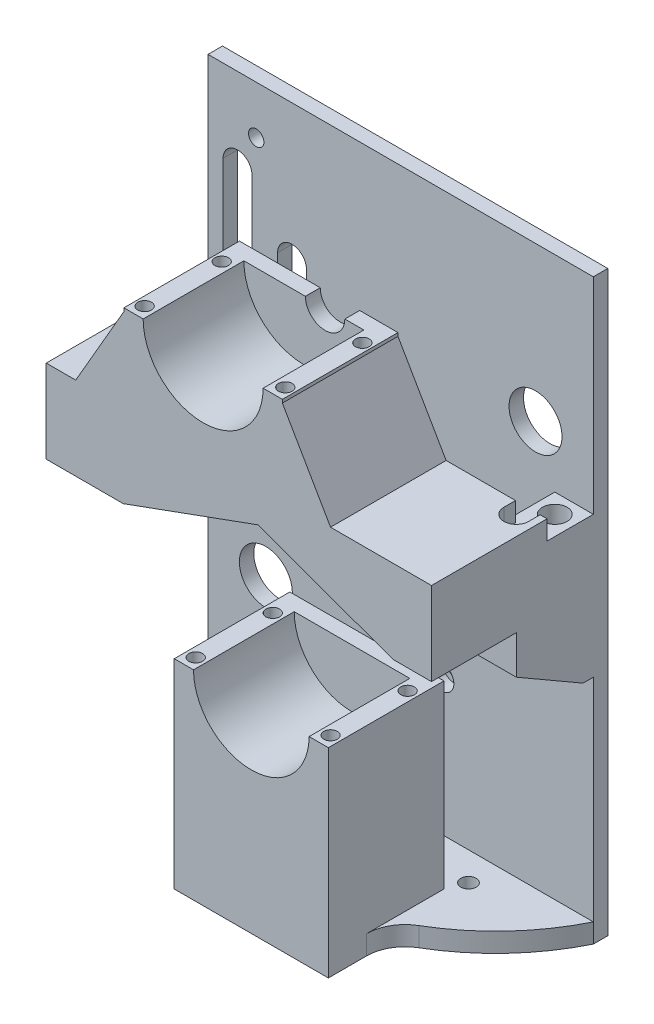
from build123d import *
from OCP.BRepFilletAPI import BRepFilletAPI_MakeChamfer

# Parameters (mm, degrees)
SKETCH1_W                      = 127
SKETCH1_H                      = 101.6
BOSS_EXTRUDE1_DEPTH            = 4.7625
SKETCH2_W                      = 127
SKETCH2_H                      = 6.35
BOSS_EXTRUDE2_DEPTH            = 50.8
CUT_EXTRUDE1_DEPTH             = 96.882897328
CUT_EXTRUDE1_DEPTH_BACK        = 96.882897328
SKETCH3_R                      = 8.73125
CUT_EXTRUDE2_DEPTH             = 96.882897328
CUT_EXTRUDE2_DEPTH_BACK        = 96.882897328
SKETCH4_R                      = 2.286
CUT_EXTRUDE3_DEPTH             = 128.247805114
CUT_EXTRUDE3_DEPTH_BACK        = 128.247805114
SKETCH5_R                      = 2.54
CUT_EXTRUDE4_START             = -6.35
CUT_EXTRUDE4_DEPTH             = 6.35
SKETCH7_R                      = 4.064
CUT_EXTRUDE5_DEPTH             = 4.318
BOSS_EXTRUDE3_DEPTH            = 38.1
BOSS_EXTRUDE4_DEPTH            = 4.9
SKETCH15_W                     = 25.4
SKETCH15_H                     = 25.4
SKETCH15_W_2                   = 12.7
BOSS_EXTRUDE5_DEPTH            = 25.4
CHAMFER1_SIZE                  = 12.7
CHAMFER1_SIZE2                 = 21.997045256
SKETCH17_W                     = 127
SKETCH17_H                     = 4.7625
BOSS_EXTRUDE6_DEPTH            = 88.9
CUT_EXTRUDE7_DEPTH             = 163.460750952
CUT_EXTRUDE7_DEPTH_BACK        = 163.460750952
SKETCH18_R                     = 8.73125
SKETCH31_R                     = 2.249999945
CUT_EXTRUDE16_DEPTH            = 7
BOSS_EXTRUDE7_DEPTH            = 53.34
SKETCH20_W                     = 127
SKETCH20_H                     = 27.442580258
BOSS_EXTRUDE8_DEPTH            = 53.34
CUT_EXTRUDE8_REACH             = 166.086
CUT_EXTRUDE8_DIRECTION_2_DEPTH = 165.086076515
CHAMFER2_SIZE                  = 15.875
CHAMFER2_SIZE2                 = 27.49630657
CUT_EXTRUDE9_DEPTH             = 198.537314212
CUT_EXTRUDE9_DEPTH_BACK        = 198.537314212
SKETCH22_W                     = 15.24
SKETCH22_H                     = 47.382896715
SKETCH23_W                     = 88.9
SKETCH23_H                     = 15.24
CUT_EXTRUDE10_DEPTH            = 134.156714086
BOSS_EXTRUDE9_DEPTH            = 4.9
SKETCH16_R                     = 2.25
CUT_EXTRUDE6_DEPTH             = 134.156714086
SKETCH26_R                     = 4.064
CUT_EXTRUDE11_DEPTH            = 21.092580258
SKETCH27_W                     = 7.440852829
SKETCH27_H                     = 3.81
SKETCH27_W_2                   = 8.128
CUT_EXTRUDE12_DEPTH            = 6.35
CUT_EXTRUDE13_DEPTH            = 163.460750952
CUT_EXTRUDE13_DEPTH_BACK       = 163.460750952
SKETCH28_R                     = 2.54
CUT_EXTRUDE14_DEPTH            = 165.086076515
CUT_EXTRUDE14_DEPTH_BACK       = 4.7625
SKETCH29_W                     = 9.525
SKETCH29_H                     = 38.1
FILLET1_R                      = 4.7625
SKETCH30_R                     = 2.25
CUT_EXTRUDE15_DEPTH            = 7
BOSS_EXTRUDE10_START           = 6.35
BOSS_EXTRUDE10_DEPTH           = 6.35
FILLET2_R                      = 12.7


# Read off the part's stored shape, not the designer's step: Cut-Extrude4
with BuildPart() as part:
    # Sketch1 → Boss-Extrude1 (new body)
    with BuildSketch(Plane.XY):
        Rectangle(SKETCH1_W, SKETCH1_H)
    extrude(amount=BOSS_EXTRUDE1_DEPTH)

    # Sketch2 → Boss-Extrude2 (add)
    with BuildSketch(Plane.XY.offset(4.7625)):
        with Locations((0, -47.625)):
            Rectangle(SKETCH2_W, SKETCH2_H)
    extrude(amount=BOSS_EXTRUDE2_DEPTH)

    # Sketch3 → Cut-Extrude1 (cut, two sides: drawn at the far end of the back side and taken through both)
    with BuildSketch(Plane.XY.offset(4.7625).offset(-CUT_EXTRUDE1_DEPTH_BACK)):
        with Locations((-44.45, 0)):
            Circle(SKETCH3_R)
    extrude(amount=CUT_EXTRUDE1_DEPTH + CUT_EXTRUDE1_DEPTH_BACK, mode=Mode.SUBTRACT)

    # Sketch4 → Cut-Extrude2 (cut, two sides: drawn at the far end of the back side and taken through both)
    with BuildSketch(Plane.XY.offset(4.7625).offset(-CUT_EXTRUDE2_DEPTH_BACK)):
        with Locations((13.462, 0.508)):
            Circle(SKETCH4_R)
    extrude(amount=CUT_EXTRUDE2_DEPTH + CUT_EXTRUDE2_DEPTH_BACK, mode=Mode.SUBTRACT)

    # Sketch5 → Cut-Extrude3 (cut, two sides: drawn at the far end of the back side and taken through both)
    with BuildSketch(Plane(origin=(0, -44.45, 0), x_dir=(1, 0, 0), z_dir=(0, 1, 0)).offset(-CUT_EXTRUDE3_DEPTH_BACK)):
        with Locations(Location((-31.75, -14.1605, 0), (0, 0, 270))):
            Circle(SKETCH5_R)
        with Locations(Location((0, -14.1605, 0), (0, 0, 270))):
            Circle(SKETCH5_R)
        with Locations(Location((31.75, -14.1605, 0), (0, 0, 270))):
            Circle(SKETCH5_R)
    extrude(amount=CUT_EXTRUDE3_DEPTH + CUT_EXTRUDE3_DEPTH_BACK, mode=Mode.SUBTRACT)

    # Cut-Extrude4 outline → Cut-Extrude4 (cut)
    with BuildSketch(Plane(origin=(0, -44.45, 0), x_dir=(1, 0, 0), z_dir=(0, 1, 0)).offset(CUT_EXTRUDE4_START)):
        with BuildLine():
            ThreePointArc((63.5, -4.7625), (0, -44.289932413), (-63.5, -4.7625))
            Line((-63.5, -4.7625), (-63.5, -55.5625))
            Line((-63.5, -55.5625), (63.5, -55.5625))
            Line((63.5, -55.5625), (63.5, -4.7625))
        make_face()
    extrude(amount=CUT_EXTRUDE4_DEPTH, mode=Mode.SUBTRACT)

    # Sketch7 → Cut-Extrude5 (cut)
    with BuildSketch(Plane.XY.offset(4.7625)):
        with Locations((13.462, 0.508)):
            Circle(SKETCH7_R)
    extrude(amount=-CUT_EXTRUDE5_DEPTH, mode=Mode.SUBTRACT)

    # Sketch11 → Boss-Extrude3 (add)
    with BuildSketch(Plane.XY.offset(20.0025)):
        with BuildLine():
            Line((-14.949479175, 14.949479175), (-21.299479175, 14.949479175))
            Line((-21.299479175, 14.949479175), (-21.299479175, -44.45))
            Line((-21.299479175, -44.45), (29.500520825, -44.45))
            Line((29.500520825, -44.45), (29.500520825, 14.949479175))
            Line((29.500520825, 14.949479175), (23.150520825, 14.949479175))
            ThreePointArc((23.150520825, 14.949479175), (4.100520825, -4.100520825), (-14.949479175, 14.949479175))
        make_face()
    extrude(amount=BOSS_EXTRUDE3_DEPTH)

    # Sketch14 → Boss-Extrude4 (add)
    with BuildSketch(Plane.XY.offset(20.0025)):
        with BuildLine():
            Line((-14.949479175, 14.949479175), (23.150520825, 14.949479175))
            ThreePointArc((23.150520825, 14.949479175), (4.100520825, -4.100520825), (-14.949479175, 14.949479175))
        make_face()
    extrude(amount=BOSS_EXTRUDE4_DEPTH)

    # Sketch15 → Boss-Extrude5 (add)
    with BuildSketch(Plane.XY.offset(4.7625)):
        with Locations((-50.8, 38.1)):
            Rectangle(SKETCH15_W, SKETCH15_H)
        with Locations((57.15, 38.1)):
            Rectangle(SKETCH15_W_2, SKETCH15_H)
    extrude(amount=BOSS_EXTRUDE5_DEPTH)

    # Chamfer1: one chamfer whose edges measure the first distance from different faces: ONE call of the kernel's chamfer builder (chamfer() names one face for all edges)
    chamfer1_edges_1 = [part.edges().sort_by_distance(p)[0] for p in [
        (-50.8, 25.4, 30.1625),
    ]]
    chamfer1_side_1 = [part.faces().sort_by_distance(p)[0] for p in [
        (-50.8, 38.1, 30.1625),
    ]]
    chamfer1_edges_2 = [part.edges().sort_by_distance(p)[0] for p in [
        (57.15, 25.4, 30.1625),
    ]]
    chamfer1_side_2 = [part.faces().sort_by_distance(p)[0] for p in [
        (57.15, 38.1, 30.1625),
    ]]
    chamfer1 = BRepFilletAPI_MakeChamfer(part.part.solid().wrapped)
    for e in chamfer1_edges_1:
        chamfer1.Add(CHAMFER1_SIZE, CHAMFER1_SIZE2, e.wrapped, chamfer1_side_1[0].wrapped)  # the first distance lies on this face
    for e in chamfer1_edges_2:
        chamfer1.Add(CHAMFER1_SIZE, CHAMFER1_SIZE2, e.wrapped, chamfer1_side_2[0].wrapped)  # the first distance lies on this face
    add(Compound.cast(chamfer1.Shape()), mode=Mode.REPLACE)

    # Sketch17 → Boss-Extrude6 (add)
    with BuildSketch(Plane(origin=(0, 50.8, 0), x_dir=(1, 0, 0), z_dir=(0, 1, 0))):
        with Locations((0, -2.38125)):
            Rectangle(SKETCH17_W, SKETCH17_H)
    extrude(amount=BOSS_EXTRUDE6_DEPTH)

    # Sketch18 → Cut-Extrude7 (cut, two sides: drawn at the far end of the back side and taken through both)
    with BuildSketch(Plane.XY.offset(4.7625).offset(-CUT_EXTRUDE7_DEPTH_BACK)):
        with Locations((44.45, 88.9)):
            Circle(SKETCH18_R)
    extrude(amount=CUT_EXTRUDE7_DEPTH + CUT_EXTRUDE7_DEPTH_BACK, mode=Mode.SUBTRACT)

    # Sketch31 → Cut-Extrude16 (cut)
    with BuildSketch(Plane(origin=(0, 14.949479175, 0), x_dir=(1, 0, 0), z_dir=(0, 1, 0))):
        with Locations(Location((-18.124479175, -28.8025, 0), (0, 0, 270))):
            Circle(SKETCH31_R)
        with Locations(Location((26.325520825, -28.8025, 0), (0, 0, 270))):
            Circle(SKETCH31_R)
        with Locations(Location((26.325520825, -54.2025, 0), (0, 0, 270))):
            Circle(SKETCH31_R)
        with Locations(Location((-18.124479175, -54.2025, 0), (0, 0, 270))):
            Circle(SKETCH31_R)
    extrude(amount=-CUT_EXTRUDE16_DEPTH, mode=Mode.SUBTRACT)

    # Sketch19 → Boss-Extrude7 (add)
    with BuildSketch(Plane.XY.offset(4.7625)):
        with BuildLine():
            Line((-31.548147171, 106.817580258), (-37.898147171, 106.817580258))
            Line((-37.898147171, 106.817580258), (-37.898147171, 78.242580258))
            Line((-37.898147171, 78.242580258), (14.341852829, 78.242580258))
            Line((14.341852829, 78.242580258), (14.341852829, 106.817580258))
            Line((14.341852829, 106.817580258), (7.991852829, 106.817580258))
            ThreePointArc((7.991852829, 106.817580258), (-11.778147171, 87.047580258), (-31.548147171, 106.817580258))
        make_face()
    extrude(amount=BOSS_EXTRUDE7_DEPTH)

    # Sketch20 → Boss-Extrude8 (add)
    with BuildSketch(Plane.XY.offset(4.7625)):
        with Locations((0, 64.521290129)):
            Rectangle(SKETCH20_W, SKETCH20_H)
    extrude(amount=BOSS_EXTRUDE8_DEPTH)

    # Cut-Extrude8: up to this face of the body (flat: up to its plane)
    cut_extrude8_end = Plane(part.part.faces().sort_by_distance((2.240886483, 0.139322847, 4.7625))[0])
    # Sketch21 → Cut-Extrude8 (cut, up to the picked face)
    with BuildSketch(Plane.XY.offset(58.1025), mode=Mode.PRIVATE) as cut_extrude8_sk1:
        Polygon((-38.1, 50.8), (6.35, 66.978476913), (50.8, 50.8), align=None)
    cut_extrude8_tool1 = split(extrude(cut_extrude8_sk1.sketch, amount=-CUT_EXTRUDE8_REACH, mode=Mode.PRIVATE), bisect_by=cut_extrude8_end, keep=Keep.BOTH, mode=Mode.PRIVATE)
    add(cut_extrude8_tool1.solids().sort_by(Axis((6.35, 56.192826, 58.1025), (0, 0, -1)))[0], mode=Mode.SUBTRACT)

    # Sketch21 → Cut-Extrude8 direction 2 (cut)
    with BuildSketch(Plane.XY.offset(58.1025)):
        Polygon((-38.1, 50.8), (6.35, 66.978476913), (50.8, 50.8), align=None)
    extrude(amount=CUT_EXTRUDE8_DIRECTION_2_DEPTH, mode=Mode.SUBTRACT)

    # Chamfer2: one chamfer whose edges measure the first distance from different faces: ONE call of the kernel's chamfer builder (chamfer() names one face for all edges)
    chamfer2_edges_1 = [part.edges().sort_by_distance(p)[0] for p in [
        (-37.898147171, 78.242580258, 31.4325),
    ]]
    chamfer2_side_1 = [part.faces().sort_by_distance(p)[0] for p in [
        (-50.699073586, 78.242580258, 31.4325),
    ]]
    chamfer2_edges_2 = [part.edges().sort_by_distance(p)[0] for p in [
        (14.341852829, 78.242580258, 31.4325),
    ]]
    chamfer2_side_2 = [part.faces().sort_by_distance(p)[0] for p in [
        (38.920926414, 78.242580258, 31.4325),
    ]]
    chamfer2 = BRepFilletAPI_MakeChamfer(part.part.solid().wrapped)
    for e in chamfer2_edges_1:
        chamfer2.Add(CHAMFER2_SIZE, CHAMFER2_SIZE2, e.wrapped, chamfer2_side_1[0].wrapped)  # the first distance lies on this face
    for e in chamfer2_edges_2:
        chamfer2.Add(CHAMFER2_SIZE, CHAMFER2_SIZE2, e.wrapped, chamfer2_side_2[0].wrapped)  # the first distance lies on this face
    add(Compound.cast(chamfer2.Shape()), mode=Mode.REPLACE)

    # Sketch22 → Cut-Extrude9 (cut, two sides: drawn at the far end of the back side and taken through both)
    with BuildSketch(Plane(origin=(63.5, 0, 0), x_dir=(0, 0, -1), z_dir=(1, 0, 0)).offset(-CUT_EXTRUDE9_DEPTH_BACK)):
        with Locations((-12.3825, 95.584028616)):
            Rectangle(SKETCH22_W, SKETCH22_H)
    extrude(amount=CUT_EXTRUDE9_DEPTH + CUT_EXTRUDE9_DEPTH_BACK, mode=Mode.SUBTRACT)

    # Sketch23 → Cut-Extrude10 (cut, through all)
    with BuildSketch(Plane.XZ.offset(-50.8)):
        with Locations((6.35, 12.3825)):
            Rectangle(SKETCH23_W, SKETCH23_H)
    extrude(amount=-CUT_EXTRUDE10_DEPTH, mode=Mode.SUBTRACT)

    # Sketch24 → Boss-Extrude9 (add)
    with BuildSketch(Plane.XY.offset(20.0025)):
        with BuildLine():
            Line((-11.278147171, 106.817580258), (-31.548147171, 106.817580258))
            ThreePointArc((-31.548147171, 106.817580258), (-11.778147171, 87.047580258), (7.991852829, 106.817580258))
            Line((7.991852829, 106.817580258), (1.721852829, 106.817580258))
            ThreePointArc((1.721852829, 106.817580258), (-4.778147171, 100.317580258), (-11.278147171, 106.817580258))
        make_face()
    extrude(amount=BOSS_EXTRUDE9_DEPTH)

    # Sketch16 → Cut-Extrude6 (cut, through all)
    with BuildSketch(Plane(origin=(0, 50.8, 0), x_dir=(1, 0, 0), z_dir=(0, 1, 0))):
        with Locations((57.15, -11.1125)):
            Circle(SKETCH16_R)
        with Locations((57.15, -23.8125)):
            Circle(SKETCH16_R)
        with Locations((-57.15, -11.1125)):
            Circle(SKETCH16_R)
        with Locations((-57.15, -23.8125)):
            Circle(SKETCH16_R)
    extrude(amount=CUT_EXTRUDE6_DEPTH, mode=Mode.SUBTRACT)

    # Sketch26 → Cut-Extrude11 (cut)
    with BuildSketch(Plane(origin=(0, 78.242580258, 0), x_dir=(1, 0, 0), z_dir=(0, 1, 0))):
        with Locations(Location((-57.15, -11.1125, 0), (0, 0, 270))):
            Circle(SKETCH26_R)
        with Locations(Location((-57.15, -23.8125, 0), (0, 0, 110.364134806))):
            Circle(SKETCH26_R)
        with Locations(Location((57.15, -11.1125, 0), (0, 0, 270))):
            Circle(SKETCH26_R)
        with Locations(Location((57.15, -23.8125, 0), (0, 0, 110.364134806))):
            Circle(SKETCH26_R)
    extrude(amount=-CUT_EXTRUDE11_DEPTH, mode=Mode.SUBTRACT)

    # Sketch27 → Cut-Extrude12 (cut)
    with BuildSketch(Plane(origin=(0, 78.242580258, 0), x_dir=(1, 0, 0), z_dir=(0, 1, 0))):
        with Locations((-57.493573586, -21.9075)):
            Rectangle(SKETCH27_W, SKETCH27_H)
        with Locations((57.15, -21.9075)):
            Rectangle(SKETCH27_W_2, SKETCH27_H)
    extrude(amount=-CUT_EXTRUDE12_DEPTH, mode=Mode.SUBTRACT)

    # Sketch28 → Cut-Extrude13 (cut, two sides: drawn at the far end of the back side and taken through both)
    with BuildSketch(Plane.XY.offset(4.7625).offset(-CUT_EXTRUDE13_DEPTH_BACK)):
        with Locations((-47.625, 123.825)):
            Circle(SKETCH28_R)
    extrude(amount=CUT_EXTRUDE13_DEPTH + CUT_EXTRUDE13_DEPTH_BACK, mode=Mode.SUBTRACT)

    # Sketch29 → Cut-Extrude14 (cut, two sides: drawn at the far end of the back side and taken through both)
    with BuildSketch(Plane(origin=(0, 0, 0), x_dir=(-1, 0, 0), z_dir=(0, 0, -1)).offset(-CUT_EXTRUDE14_DEPTH_BACK)):
        with Locations((35.814, 80.264)):
            Rectangle(SKETCH29_W, SKETCH29_H)
        with Locations((53.774512242, 98.224512242)):
            Rectangle(SKETCH29_W, SKETCH29_H)
    extrude(amount=CUT_EXTRUDE14_DEPTH + CUT_EXTRUDE14_DEPTH_BACK, mode=Mode.SUBTRACT)

    # Fillet1
    # the kernel refuses this fillet: 4.7625 mm, written as the material it adds along each edge
    with BuildSketch(Plane(origin=(-40.5765, 61.214, 0), x_dir=(0, 1, 0), z_dir=(0, 0, 1)), Plane(origin=(-31.0515, 99.314, 4.7625), x_dir=(-1, 0, 0), z_dir=(0, 0, -1)), Plane(origin=(-31.0515, 61.214, 4.7625), x_dir=(0, 1, 0), z_dir=(0, 0, -1)), Plane(origin=(-49.012012242, 79.174512242, 4.7625), x_dir=(0, 1, 0), z_dir=(0, 0, -1))) as fillet1_piece_1:
        with BuildLine():
            CenterArc((FILLET1_R, -FILLET1_R), FILLET1_R, 90, 90)
            Line((0, -FILLET1_R), (0, 0))
            Line((0, 0), (FILLET1_R, 0))
        make_face()
    extrude(amount=4.7625)
    with BuildSketch(Plane(origin=(-40.5765, 99.314, 0), x_dir=(0, -1, 0), z_dir=(0, 0, 1)), Plane(origin=(-58.537012242, 79.174512242, 0), x_dir=(1, 0, 0), z_dir=(0, 0, 1)), Plane(origin=(-58.537012242, 117.274512242, 0), x_dir=(0, -1, 0), z_dir=(0, 0, 1)), Plane(origin=(-49.012012242, 117.274512242, 4.7625), x_dir=(0, -1, 0), z_dir=(0, 0, -1))) as fillet1_piece_2:
        with BuildLine():
            CenterArc((FILLET1_R, FILLET1_R), FILLET1_R, 180, 90)
            Line((0, FILLET1_R), (0, 0))
            Line((0, 0), (FILLET1_R, 0))
        make_face()
    extrude(amount=4.7625)

    # Sketch30 → Cut-Extrude15 (cut)
    with BuildSketch(Plane(origin=(0, 106.817580258, 0), x_dir=(1, 0, 0), z_dir=(0, 1, 0))):
        with Locations(Location((-34.955647171, -28.8025, 0), (0, 0, 180))):
            Circle(SKETCH30_R)
        with Locations(Location((11.399352829, -28.8025, 0), (0, 0, 180))):
            Circle(SKETCH30_R)
        with Locations(Location((11.399352829, -54.2025, 0), (0, 0, 180))):
            Circle(SKETCH30_R)
        with Locations(Location((-34.955647171, -54.2025, 0), (0, 0, 180))):
            Circle(SKETCH30_R)
    extrude(amount=-CUT_EXTRUDE15_DEPTH, mode=Mode.SUBTRACT)

    # Sketch32 → Boss-Extrude10 (add)
    with BuildSketch(Plane.XZ.offset(44.45).offset(BOSS_EXTRUDE10_START)):
        with BuildLine():
            Line((29.500520825, 37.84803559), (29.500520825, 58.1025))
            Line((29.500520825, 58.1025), (-21.299479175, 58.1025))
            Line((-21.299479175, 58.1025), (-21.299479175, 41.008608218))
            ThreePointArc((-21.299479175, 41.008608218), (4.394493813, 44.15336054), (29.500520825, 37.84803559))
        make_face()
    extrude(amount=-BOSS_EXTRUDE10_DEPTH)

    # Fillet2
    # the kernel refuses this fillet: 12.7 mm, written as the material it adds along each edge
    with BuildSketch(Plane(origin=(29.500520825, -50.8, 37.84803559), x_dir=(0.8869865601391139, 0, -0.46179523831735414), z_dir=(0, 1, 0))) as fillet2_piece_1:
        with BuildLine():
            CenterArc((7.714367933, -12.684105069), FILLET2_R, 92.866885824, 59.630102423)
            Line((-3.550361381, -6.819305543), (0, 0))
            ThreePointArc((0, 0), (3.539584142, -0.088572853), (7.079168284, 0))
        make_face()
    extrude(amount=6.35)
    with BuildSketch(Plane(origin=(-21.299479175, -50.8, 41.008608218), x_dir=(-0.9349712416147754, 0, -0.3547235224133371), z_dir=(0, 1, 0))) as fillet2_piece_2:
        with BuildLine():
            CenterArc((8.772787703, 12.679440479), FILLET2_R, 200.776500664, 65.96287418)
            Line((-3.101347065, 8.174451744), (0, 0))
            ThreePointArc((0, 0), (4.025218982, 0.114565799), (8.050437963, 0))
        make_face()
    extrude(amount=6.35)


solid = part.part
